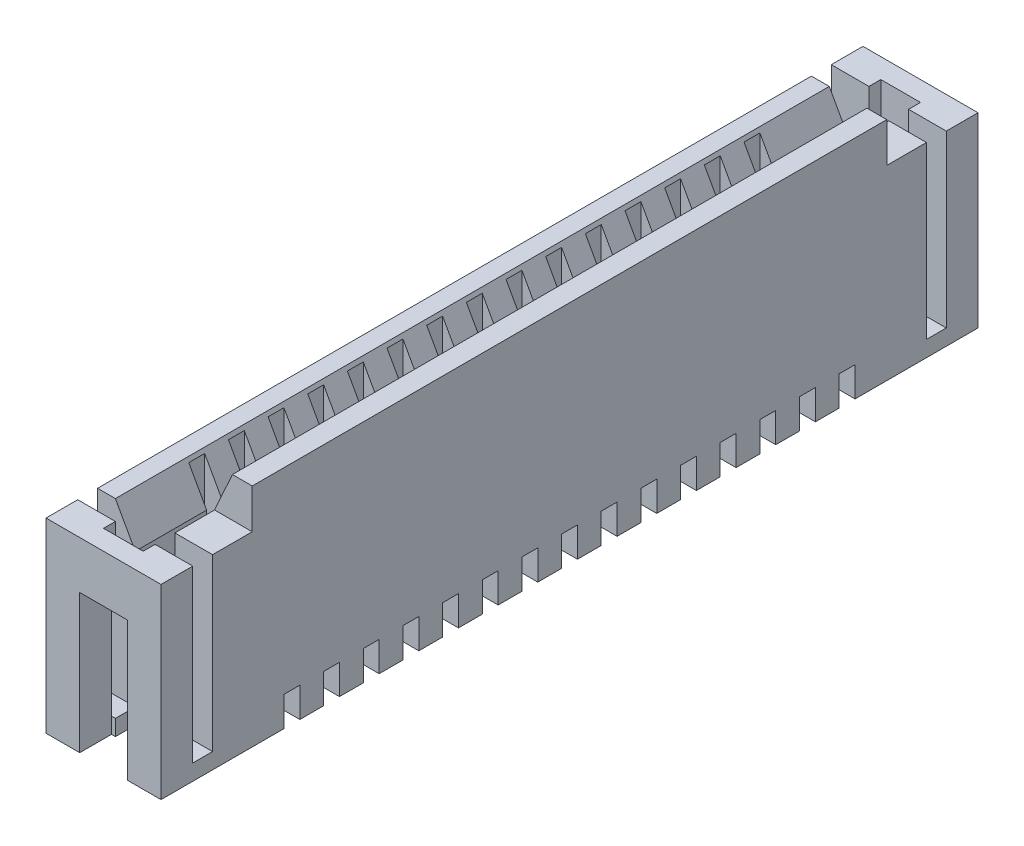
from build123d import *

# Parameters (mm, degrees)
ESBO_O1_W                 = 2.9
ESBO_O1_H                 = 20.6
RESSALTO_EXTRUS_O1_DEPTH  = 4.7
ESBO_O2_W                 = 1
ESBO_O2_H                 = 19.6
CORTE_EXTRUS_O1_DEPTH     = 4.3
ESBO_O3_W                 = 6.892314873
ESBO_O3_H                 = 0.5
ESBO_O3_W_2               = 7.332249865
CORTE_EXTRUS_O2_DEPTH     = 4.3
CHANFRO2_SIZE             = 0.5
CHANFRO2_SIZE2            = 0.902023878
RESSALTO_EXTRUS_O2_DEPTH  = 8
ESBO_O5_W                 = 1
ESBO_O5_H                 = 1.1
CORTE_EXTRUS_O3_DEPTH     = 2
ESBO_O6_W                 = 1
ESBO_O6_H                 = 0.4
RESSALTO_EXTRUS_O3_DEPTH  = 2
CORTE_EXTRUS_O4_START     = -4.3
ESBO_O7_W                 = 0.7
ESBO_O7_H                 = 0.4
CORTE_EXTRUS_O4_DEPTH     = 6.3
ESBO_O8_W                 = 0.4
ESBO_O8_H                 = 1
CORTE_EXTRUS_O7_DEPTH     = 6.05
PADR_O_LINEAR1_COUNT      = 8
PADR_O_LINEAR1_PITCH      = 1
PADR_O_LINEAR1_COUNT_DIR2 = 8
PADR_O_LINEAR1_PITCH_DIR2 = 1
ESBO_O9_W                 = 1.2
ESBO_O9_H                 = 4.437339102
CORTE_EXTRUS_O6_DEPTH     = 0.8


with BuildPart() as part:
    # Esboço1 → Ressalto-extrusão1 (new body)
    with BuildSketch(Plane(origin=(0, 0, 0), x_dir=(1, 0, 0), z_dir=(0, 1, 0))):
        Rectangle(ESBO_O1_W, ESBO_O1_H)
    extrude(amount=RESSALTO_EXTRUS_O1_DEPTH)

    # Esboço2 → Corte-extrusão1 (cut)
    with BuildSketch(Plane(origin=(0, 4.7, 0), x_dir=(1, 0, 0), z_dir=(0, 1, 0))):
        Rectangle(ESBO_O2_W, ESBO_O2_H)
    extrude(amount=-CORTE_EXTRUS_O1_DEPTH, mode=Mode.SUBTRACT)

    # Esboço3 → Corte-extrusão2 (cut)
    with BuildSketch(Plane(origin=(0, 4.7, 0), x_dir=(1, 0, 0), z_dir=(0, 1, 0))):
        with Locations((0.16072145, 9.25)):
            Rectangle(ESBO_O3_W, ESBO_O3_H)
        with Locations((0.380688946, -9.25)):
            Rectangle(ESBO_O3_W_2, ESBO_O3_H)
    extrude(amount=-CORTE_EXTRUS_O2_DEPTH, mode=Mode.SUBTRACT)

    # Chanfro2
    chanfro2_edges = [part.edges().sort_by_distance(p)[0] for p in [
        (-0.5, 4.7, 0),
    ]]
    chanfro2_side = [part.faces().sort_by_distance(p)[0] for p in [
        (-0.975, 4.7, 0),
    ]]
    chamfer(chanfro2_edges, length=CHANFRO2_SIZE, length2=CHANFRO2_SIZE2, reference=chanfro2_side[0])

    # Esboço4 → Ressalto-extrusão2 (add, symmetric)
    with BuildSketch(Plane.XY):
        Polygon((1.45, 4.7), (1.45, 5.7), (0.95, 5.7), (0.5, 4.7), align=None)
    extrude(amount=RESSALTO_EXTRUS_O2_DEPTH, both=True)

    # Esboço5 → Corte-extrusão3 (cut)
    with BuildSketch(Plane(origin=(0, 0.4, 0), x_dir=(1, 0, 0), z_dir=(0, 1, 0))):
        with Locations((0, 9.25)):
            Rectangle(ESBO_O5_W, ESBO_O5_H)
        with Locations((0, -9.25)):
            Rectangle(ESBO_O5_W, ESBO_O5_H)
    extrude(amount=-CORTE_EXTRUS_O3_DEPTH, mode=Mode.SUBTRACT)

    # Esboço6 → Ressalto-extrusão3 (add)
    with BuildSketch(Plane(origin=(0, 0.4, 0), x_dir=(1, 0, 0), z_dir=(0, 1, 0))):
        with Locations((0, 8.5)):
            Rectangle(ESBO_O6_W, ESBO_O6_H)
        with Locations((0, -8.5)):
            Rectangle(ESBO_O6_W, ESBO_O6_H)
    extrude(amount=RESSALTO_EXTRUS_O3_DEPTH)

    # Esboço7 → Corte-extrusão4 (cut)
    with BuildSketch(Plane(origin=(0, 4.7, 0), x_dir=(1, 0, 0), z_dir=(0, 1, 0)).offset(CORTE_EXTRUS_O4_START)):
        with Locations((-0.6, 0)):
            Rectangle(ESBO_O7_W, ESBO_O7_H)
        with Locations((0.6, 0)):
            Rectangle(ESBO_O7_W, ESBO_O7_H)
    corte_extrus_o4 = extrude(amount=CORTE_EXTRUS_O4_DEPTH, mode=Mode.SUBTRACT)

    # Esboço8 → Corte-extrusão7 (cut, symmetric)
    with BuildSketch(Plane(origin=(0, 0, 0), x_dir=(0, 0, -1), z_dir=(1, 0, 0))):
        with Locations((0, 0.25)):
            Rectangle(ESBO_O8_W, ESBO_O8_H)
    corte_extrus_o7 = extrude(amount=CORTE_EXTRUS_O7_DEPTH, both=True, mode=Mode.SUBTRACT)

    # Padrão linear1: Corte-extrusão4, Corte-extrus_o7 8 × 8
    with Locations(*[Vector(0, 0, 1) * (i * PADR_O_LINEAR1_PITCH) + Vector(0, 0, -1) * (j * PADR_O_LINEAR1_PITCH_DIR2) for i in range(PADR_O_LINEAR1_COUNT) for j in range(PADR_O_LINEAR1_COUNT_DIR2) if (i, j) != (0, 0)]):
        add(corte_extrus_o4, mode=Mode.SUBTRACT)
        add(corte_extrus_o7, mode=Mode.SUBTRACT)

    # Esboço9 → Corte-extrusão6 (cut)
    with BuildSketch(Plane.XY.offset(10.3)):
        with Locations((0, 1.281330449)):
            Rectangle(ESBO_O9_W, ESBO_O9_H)
    corte_extrus_o6 = extrude(amount=-CORTE_EXTRUS_O6_DEPTH, mode=Mode.SUBTRACT)

    # Espelhar1: Corte-extrusão6 across plane
    add(corte_extrus_o6.mirror(Plane.XY), mode=Mode.SUBTRACT)


solid = part.part
